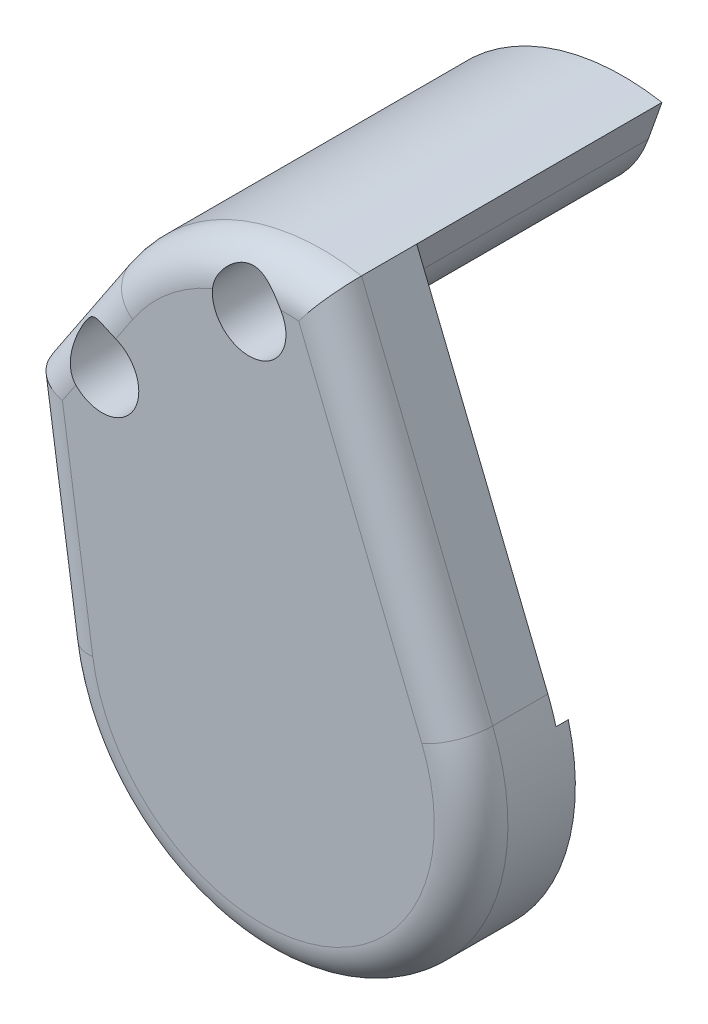
from build123d import *

# Parameters (mm, degrees)
SKETCH1_R                = 1.75
BOSS_EXTRUDE1_DEPTH      = 23
FILLET3_R                = 10
BOSS_EXTRUDE2_DEPTH      = 4.5
BOSS_EXTRUDE2_DEPTH_BACK = 4
SKETCH3_R                = 1.75
SKETCH4_R                = 11.25
CUT_EXTRUDE1_DEPTH       = 7
SKETCH5_R                = 13
CUT_EXTRUDE2_DEPTH       = 1.5
SKETCH6_R                = 3
CUT_EXTRUDE3_DEPTH       = 12
CUT_EXTRUDE4_DEPTH       = 1
FILLET7_R                = 3
FILLET8_R                = 10


with BuildPart() as part:
    # Sketch1 → Boss-Extrude1 (new body)
    with BuildSketch(Plane.XY):
        with BuildLine():
            Line((-8.845360825, 11.520618557), (-14.845360825, 2.520618557))
            Line((-14.845360825, 2.520618557), (-14.845360825, -0.479381443))
            Line((-14.845360825, -0.479381443), (-9.845360825, -0.479381443))
            Line((-9.845360825, -0.479381443), (-8.845360825, 0.520618557))
            ThreePointArc((-8.845360825, 0.520618557), (-1.696742799, 7.320595709), (6.83903909, 12.26861112))
            Line((6.83903909, 12.26861112), (9.318301605, 19.26861112))
            ThreePointArc((9.318301605, 19.26861112), (-0.918731235, 18.102760488), (-8.845360825, 11.520618557))
        make_face()
        with Locations((-8.845360825, 5.020618557)):
            Circle(SKETCH1_R, mode=Mode.SUBTRACT)
        with Locations((3.154639175, 15.020618557)):
            Circle(SKETCH1_R, mode=Mode.SUBTRACT)
    extrude(amount=BOSS_EXTRUDE1_DEPTH)

    # Fillet3
    # the kernel refuses this fillet: 10 mm, written as the material it takes off along each edge
    with BuildSketch(Plane(origin=(-9.845360825, -0.479381443, -10.932362995), x_dir=(-1, 0, 0), z_dir=(0, 0, 1))) as fillet3_piece_1:
        with BuildLine():
            CenterArc((4.372945198, -10), FILLET3_R, 90, 46.455884642)
            Line((-2.87549632, -3.110871204), (-3.600340471, -2.421958325))
            ThreePointArc((-3.600340471, -2.421958325), (-1.769425443, -0.361263367), (-0.707106781, 0.707106781))
            Line((-0.707106781, 0.707106781), (0, 1))
            Line((0, 1), (4.372945198, 1))
            Line((4.372945198, 1), (4.372945198, 0))
        make_face()
    extrude(amount=44.86472599, mode=Mode.SUBTRACT)

    # Sketch3 → Boss-Extrude2 (add, two sides: drawn at the far end of the back side and taken through both)
    with BuildSketch(Plane.XY.offset(23).offset(-BOSS_EXTRUDE2_DEPTH_BACK)):
        with BuildLine():
            Line((-14.845360825, 2.520618557), (-14.845360825, -0.479381443))
            Line((-14.845360825, -0.479381443), (-12.565000182, -16.009144975))
            ThreePointArc((-12.565000182, -16.009144975), (8.709502938, -29.945300767), (20.013420995, -7.162799635))
            Line((20.013420995, -7.162799635), (9.318301605, 19.26861112))
            ThreePointArc((9.318301605, 19.26861112), (-0.918731235, 18.102760488), (-8.845360825, 11.520618557))
            Line((-8.845360825, 11.520618557), (-14.845360825, 2.520618557))
        make_face()
        with Locations((3.154639175, 15.020618557)):
            Circle(SKETCH3_R, mode=Mode.SUBTRACT)
        with Locations((-8.845360825, 5.020618557)):
            Circle(SKETCH3_R, mode=Mode.SUBTRACT)
    extrude(amount=BOSS_EXTRUDE2_DEPTH + BOSS_EXTRUDE2_DEPTH_BACK)

    # Sketch4 → Cut-Extrude1 (cut)
    with BuildSketch(Plane(origin=(0, 0, 19), x_dir=(-1, 0, 0), z_dir=(0, 0, -1))):
        with Locations((-4.254639175, -13.539381443)):
            Circle(SKETCH4_R)
    extrude(amount=-CUT_EXTRUDE1_DEPTH, mode=Mode.SUBTRACT)

    # Sketch5 → Cut-Extrude2 (cut)
    with BuildSketch(Plane(origin=(0, 0, 19), x_dir=(-1, 0, 0), z_dir=(0, 0, -1))):
        with Locations((-4.254639175, -13.539381443)):
            Circle(SKETCH5_R)
    extrude(amount=-CUT_EXTRUDE2_DEPTH, mode=Mode.SUBTRACT)

    # Sketch6 → Cut-Extrude3 (cut)
    with BuildSketch(Plane.XY.offset(27.5)):
        with Locations((-8.845360825, 5.020618557)):
            Circle(SKETCH6_R)
        with Locations((3.154639175, 15.020618557)):
            Circle(SKETCH6_R)
    extrude(amount=-CUT_EXTRUDE3_DEPTH, mode=Mode.SUBTRACT)

    # Sketch7 → Cut-Extrude4 (cut)
    with BuildSketch(Plane(origin=(0, 0, 19), x_dir=(-1, 0, 0), z_dir=(0, 0, -1))):
        with BuildLine():
            Line((-19.320512006, -15.73138888), (-26.521187379, 19.26861112))
            Line((-26.521187379, 19.26861112), (-9.318301605, 19.26861112))
            Line((-9.318301605, 19.26861112), (-6.83903909, 12.26861112))
            ThreePointArc((-6.83903909, 12.26861112), (0.552528201, 8.148031782), (6.969864505, 2.631489761))
            Line((6.969864505, 2.631489761), (-2.943055137, 1.26861112))
            ThreePointArc((-2.943055137, 1.26861112), (-15.267616881, -3.247010549), (-19.320512006, -15.73138888))
        make_face()
    extrude(amount=-CUT_EXTRUDE4_DEPTH, mode=Mode.SUBTRACT)

    # Fillet7
    # the kernel refuses this fillet: 3 mm, written as the material it takes off along each edge
    with BuildSketch(Plane(origin=(-8.845360825, 11.520618557, 27.5), x_dir=(0, 0, -1), z_dir=(-0.554700196225229, -0.8320502943378438, 0))) as fillet7_piece_1:
        with BuildLine():
            CenterArc((FILLET7_R, FILLET7_R), FILLET7_R, 180, 90)
            Line((0, FILLET7_R), (0, 0))
            Line((0, 0), (FILLET7_R, 0))
        make_face()
    extrude(amount=18.316653826, mode=Mode.SUBTRACT)
    with BuildSketch(Plane(origin=(-18.114165499, 21.781905941, 27.5), x_dir=(0, 0, -1), z_dir=(0.14528020772302286, -0.9893905504116943, 0))) as fillet7_piece_2:
        with BuildLine():
            CenterArc((FILLET7_R, FILLET7_R), FILLET7_R, 180, 90)
            Line((0, FILLET7_R), (0, 0))
            Line((0, 0), (FILLET7_R, 0))
        make_face()
    extrude(amount=38.196292556, mode=Mode.SUBTRACT)
    with BuildSketch(Plane(origin=(4.254639175, -13.539381443, 27.5), x_dir=(-0.9893905504116943, -0.14528020772302197, 0), z_dir=(-0.14528020772302197, 0.9893905504116943, 0))) as fillet7_piece_3:
        with BuildLine():
            CenterArc((17 - FILLET7_R, -FILLET7_R), FILLET7_R, 0, 90)
            Line((17 - FILLET7_R, 0), (17, 0))
            Line((17, 0), (17, -FILLET7_R))
        make_face()
    revolve(axis=Axis((4.254639175, -13.539381443, 27.5), (0, 0, 1)), revolution_arc=193.67655813, mode=Mode.SUBTRACT)
    with BuildSketch(Plane(origin=(6.154639175, 1.520618557, 27.5), x_dir=(0.5584515746383966, 0.8295371232102247, 0), z_dir=(0.8295371232102247, -0.5584515746383966, 0))) as fillet7_piece_4:
        with BuildLine():
            CenterArc((18.027756377 - FILLET7_R, -FILLET7_R), FILLET7_R, 0, 90)
            Line((18.027756377 - FILLET7_R, 0), (18.027756377, 0))
            Line((18.027756377, 0), (18.027756377, -FILLET7_R))
        make_face()
    revolve(axis=Axis((6.154639175, 1.520618557, 27.5), (0, 0, 1)), revolution_arc=90.258713785, mode=Mode.SUBTRACT)
    with BuildSketch(Plane(origin=(20.013420995, -7.162799635, 27.5), x_dir=(-0.9269871658598542, -0.3750930475643543, 0), z_dir=(-0.37509304756435435, 0.9269871658598543, 0))) as fillet7_piece_5:
        with BuildLine():
            CenterArc((FILLET7_R, -FILLET7_R), FILLET7_R, 90, 90)
            Line((0, -FILLET7_R), (0, 0))
            Line((0, 0), (FILLET7_R, 0))
        make_face()
    extrude(amount=36.013243471, mode=Mode.SUBTRACT)

    # Fillet8
    fillet8_edges = [part.edges().sort_by_distance(p)[0] for p in [
        (6.83903909, 12.26861112, 10),
    ]]
    fillet(fillet8_edges, radius=FILLET8_R)


solid = part.part
